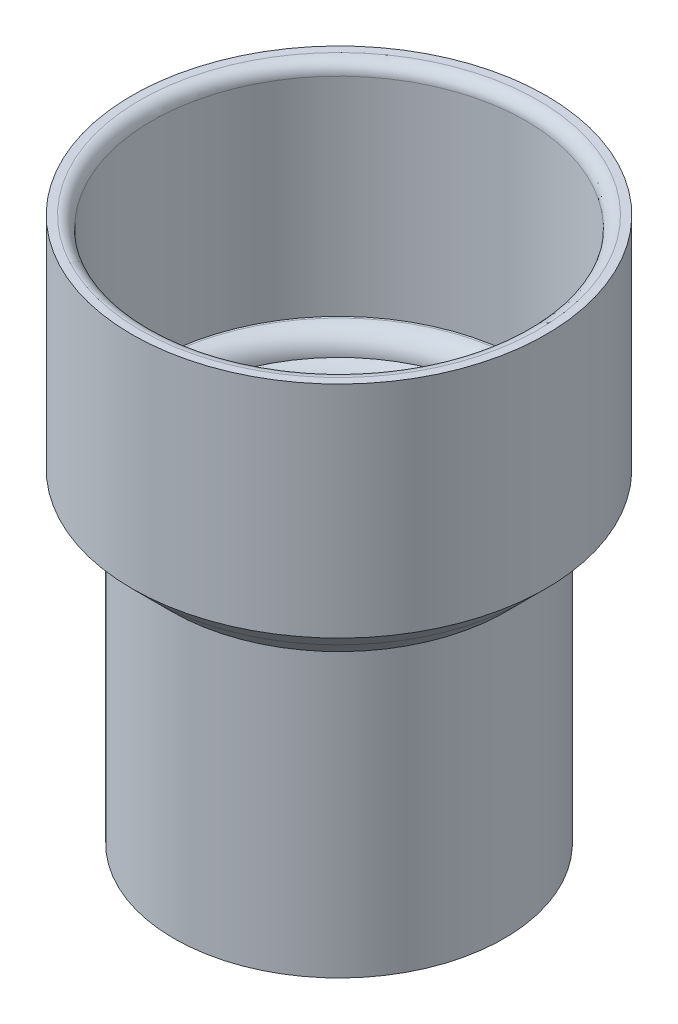
from build123d import *

# Parameters (mm, degrees)
SKETCH1_R                = 41.25
SKETCH1_R_2              = 37.5
BOSS_EXTRUDE2_DEPTH      = 76
SKETCH2_R                = 51.75
SKETCH2_R_2              = 46.75
BOSS_EXTRUDE3_DEPTH      = 60
BOSS_EXTRUDE5_DEPTH      = 5
BOSS_EXTRUDE5_DEPTH_BACK = 5
SKETCH3_R                = 46.75
SKETCH3_R_2              = 41.25
CHAMFER1_SIZE            = 5
CHAMFER2_SIZE            = 5
FILLET1_R                = 5
FILLET2_R                = 5
FILLET3_R                = 3


# Some blends are built 0.0001 mm under size
with BuildPart() as part:
    # Sketch1 → Boss-Extrude2 (new body)
    with BuildSketch(Plane(origin=(0, 0, 0), x_dir=(1, 0, 0), z_dir=(0, 1, 0))):
        with Locations(Location((0, 0, 0), (0, 0, 270))):
            Circle(SKETCH1_R)
        with Locations(Location((0, 0, 0), (0, 0, 270))):
            Circle(SKETCH1_R_2, mode=Mode.SUBTRACT)
    extrude(amount=BOSS_EXTRUDE2_DEPTH)



with BuildPart() as body_2:
    # Sketch2 → Boss-Extrude3 (new body)
    with BuildSketch(Plane(origin=(0, 76, 0), x_dir=(1, 0, 0), z_dir=(0, 1, 0))):
        with Locations(Location((0, 0, 0), (0, 0, 270))):
            Circle(SKETCH2_R)
        with Locations(Location((0, 0, 0), (0, 0, 270))):
            Circle(SKETCH2_R_2, mode=Mode.SUBTRACT)
    extrude(amount=BOSS_EXTRUDE3_DEPTH)


with BuildPart() as part_1:
    add(part.part)

    add(body_2.part)  # Boss-Extrude5 merges body 2
    # Sketch3 → Boss-Extrude5 (add, two sides: drawn at the far end of the back side and taken through both)
    with BuildSketch(Plane(origin=(0, 76, 0), x_dir=(1, 0, 0), z_dir=(0, 1, 0)).offset(-BOSS_EXTRUDE5_DEPTH_BACK)):
        with Locations(Location((0, 0, 0), (0, 0, 270))):
            Circle(SKETCH3_R)
        with Locations(Location((0, 0, 0), (0, 0, 270))):
            Circle(SKETCH3_R_2, mode=Mode.SUBTRACT)
    extrude(amount=BOSS_EXTRUDE5_DEPTH + BOSS_EXTRUDE5_DEPTH_BACK)

    # Chamfer1
    chamfer1_edges = [part_1.edges().sort_by_distance(p)[0] for p in [
        (0, 71, -46.75),
    ]]
    chamfer(chamfer1_edges, length=CHAMFER1_SIZE - 0.0001)  # a hair under: the kernel refuses the full size

    # Chamfer2
    chamfer2_edges = [part_1.edges().sort_by_distance(p)[0] for p in [
        (0, 76, -51.75),
    ]]
    chamfer(chamfer2_edges, length=CHAMFER2_SIZE - 0.0001)  # a hair under: the kernel refuses the full size

    # Fillet1
    fillet1_edges = [part_1.edges().sort_by_distance(p)[0] for p in [
        (0, 81, -41.25),
    ]]
    fillet(fillet1_edges, radius=FILLET1_R - 0.0001)  # a hair under: the kernel refuses the full size

    # Fillet2
    # the kernel refuses this fillet: 5 mm, written as the material it takes off along each edge
    with BuildSketch(Plane(origin=(0, 76, 0), x_dir=(0, 0, 1), z_dir=(-1, 0, 0))) as fillet2_piece_1:
        with BuildLine():
            CenterArc((42.5, -4.841229183), FILLET2_R, 104.477512186, 75.522487814)
            Line((37.5, -4.841229183), (37.4, -4.841229183))
            Line((37.4, -4.841229183), (37.4, 0))
            Line((37.4, 0), (37.5, 0.1))
            ThreePointArc((37.5, 0.1), (39.375, 0.1), (41.225, 0.096824584))
            Line((41.225, 0.096824584), (41.25, 0))
        make_face()
    revolve(axis=Axis((0, 76, 0), (0, 1, 0)), mode=Mode.SUBTRACT)

    # Fillet3
    fillet3_edges = [part_1.edges().sort_by_distance(p)[0] for p in [
        (0, 136, -46.75),
    ]]
    fillet(fillet3_edges, radius=FILLET3_R)


solid = part_1.part
